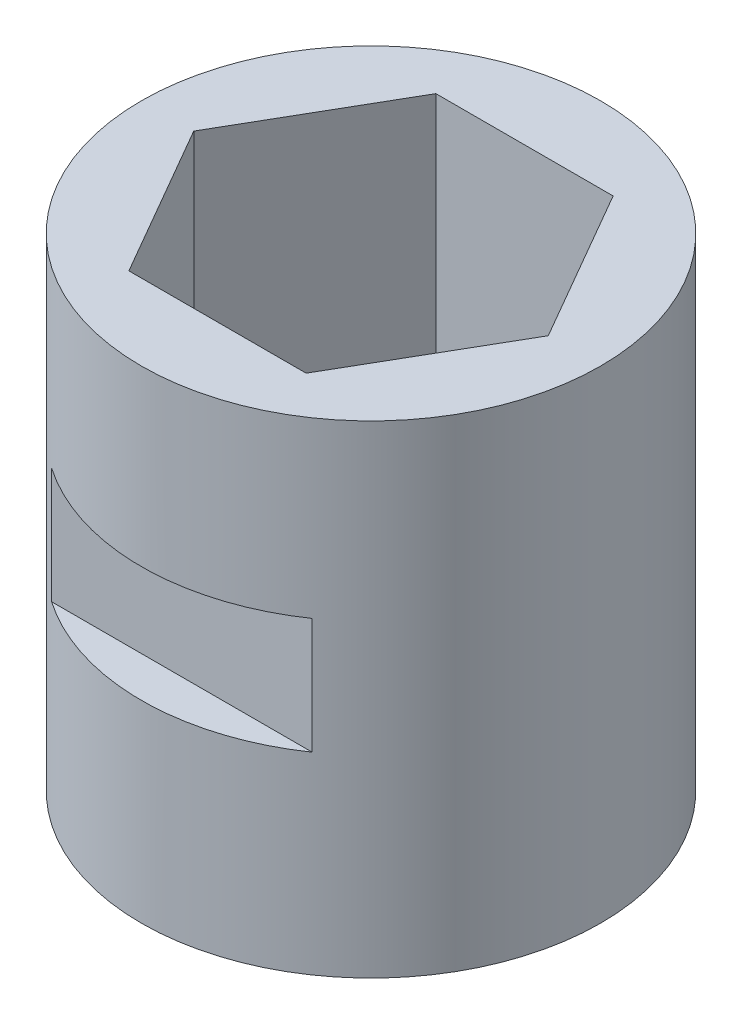
from build123d import *

# Parameters (mm, degrees)
SKETCH1_R               = 7.5565
BOSS_EXTRUDE1_DEPTH     = 12.7
BOSS_EXTRUDE2_START     = 3.175
SKETCH2_R               = 7.5565
SKETCH2_R_2             = 3.3
BOSS_EXTRUDE2_DEPTH     = 3.175
CUT_EXTRUDE1_DEPTH      = 17.597933139
CUT_EXTRUDE1_DEPTH_BACK = 17.597933139
SKETCH3_W               = 1.979009817
SKETCH3_H               = 3.81
SKETCH3_W_2             = 2.256055482


with BuildPart() as part:
    # Sketch1 → Boss-Extrude1 (new body)
    with BuildSketch(Plane(origin=(0, 0, 0), x_dir=(1, 0, 0), z_dir=(0, 1, 0))):
        Circle(SKETCH1_R)
        Polygon((-2.915618859, 5.05), (-5.831237719, 0), (-2.915618859, -5.05), (2.915618859, -5.05), (5.831237719, 0), (2.915618859, 5.05), align=None, mode=Mode.SUBTRACT)
    extrude(amount=BOSS_EXTRUDE1_DEPTH)

    # Sketch2 → Boss-Extrude2 (add)
    with BuildSketch(Plane.XZ.offset(BOSS_EXTRUDE2_START)):
        Circle(SKETCH2_R)
        Circle(SKETCH2_R_2, mode=Mode.SUBTRACT)
    extrude(amount=-BOSS_EXTRUDE2_DEPTH)

    # Sketch3 → Cut-Extrude1 (cut, two sides: drawn at the far end of the back side and taken through both)
    with BuildSketch(Plane(origin=(0, 0, 0), x_dir=(0, 0, -1), z_dir=(1, 0, 0)).offset(-CUT_EXTRUDE1_DEPTH_BACK)):
        with Locations((-7.212504909, 5.08)):
            Rectangle(SKETCH3_W, SKETCH3_H)
        with Locations((7.351027741, 5.08)):
            Rectangle(SKETCH3_W_2, SKETCH3_H)
    extrude(amount=CUT_EXTRUDE1_DEPTH + CUT_EXTRUDE1_DEPTH_BACK, mode=Mode.SUBTRACT)


solid = part.part
